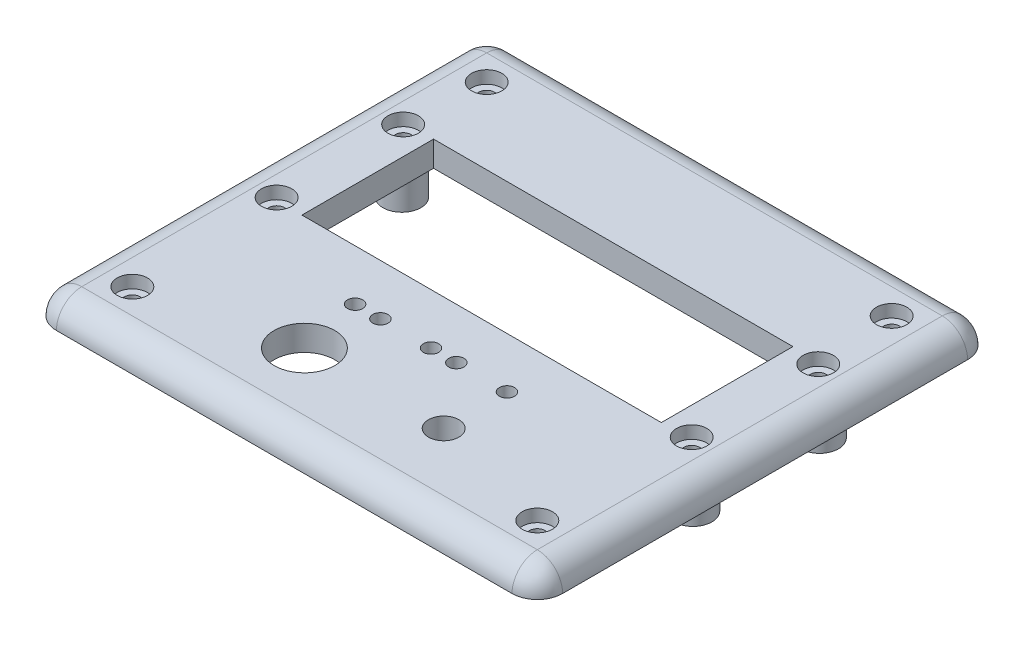
from build123d import *

# Parameters (mm, degrees)
SKETCH1_W               = 100
SKETCH1_H               = 90
BOSS_EXTRUDE1_DEPTH     = 5
FILLET1_R               = 5
FILLET2_R               = 5
SKETCH2_R               = 1.55
CUT_EXTRUDE1_DEPTH      = 10
SKETCH3_R               = 3
CUT_EXTRUDE2_DEPTH      = 2.5
SKETCH4_R               = 1.5
SKETCH4_W               = 71
SKETCH4_H               = 26
CUT_EXTRUDE3_DEPTH      = 135.629120178
SKETCH5_R               = 1.5
CUT_EXTRUDE4_DEPTH      = 135.629120178
SKETCH8_R               = 3.75
BOSS_EXTRUDE3_DEPTH     = 7.5
SKETCH6_R               = 3
CUT_EXTRUDE5_DEPTH      = 2.5
CUT_EXTRUDE7_DEPTH      = 135.745129782
CUT_EXTRUDE7_DEPTH_BACK = 135.745129782
SKETCH10_R              = 1.55
SKETCH11_R              = 6
SKETCH11_R_2            = 3
CUT_EXTRUDE8_DEPTH      = 5


with BuildPart() as part:
    # Sketch1 → Boss-Extrude1 (new body)
    with BuildSketch(Plane(origin=(0, 0, 0), x_dir=(1, 0, 0), z_dir=(0, 1, 0))):
        with Locations((50, 45)):
            Rectangle(SKETCH1_W, SKETCH1_H)
    extrude(amount=BOSS_EXTRUDE1_DEPTH)

    # Fillet1
    fillet1_edges = [part.edges().sort_by_distance(p)[0] for p in [
        (0, 2.5, -90),
        (100, 2.5, -90),
        (100, 2.5, 0),
        (0, 2.5, 0),
    ]]
    fillet(fillet1_edges, radius=FILLET1_R)

    # Fillet2
    fillet2_edges = [part.edges().sort_by_distance(p)[0] for p in [
        (1.464466094, 5, -1.464466094),
        (98.535533906, 5, -88.535533906),
        (98.535533906, 5, -1.464466094),
        (100, 5, -45),
        (50, 5, 0),
        (0, 5, -45),
        (1.464466094, 5, -88.535533906),
        (50, 5, -90),
    ]]
    fillet(fillet2_edges, radius=FILLET2_R - 0.0001)  # a hair under: the kernel refuses the full size

    # Sketch2 → Cut-Extrude1 (cut)
    with BuildSketch(Plane(origin=(0, 5, 0), x_dir=(1, 0, 0), z_dir=(0, 1, 0))):
        with Locations(Location((10, 80, 0), (0, 0, 270))):
            Circle(SKETCH2_R)
        with Locations(Location((10, 10, 0), (0, 0, 270))):
            Circle(SKETCH2_R)
        with Locations(Location((90, 10, 0), (0, 0, 270))):
            Circle(SKETCH2_R)
        with Locations(Location((90, 80, 0), (0, 0, 270))):
            Circle(SKETCH2_R)
    extrude(amount=-CUT_EXTRUDE1_DEPTH, mode=Mode.SUBTRACT)

    # Sketch3 → Cut-Extrude2 (cut)
    with BuildSketch(Plane(origin=(0, 5, 0), x_dir=(1, 0, 0), z_dir=(0, 1, 0))):
        with Locations(Location((10, 80, 0), (0, 0, 270))):
            Circle(SKETCH3_R)
        with Locations(Location((90, 80, 0), (0, 0, 270))):
            Circle(SKETCH3_R)
        with Locations(Location((90, 10, 0), (0, 0, 270))):
            Circle(SKETCH3_R)
        with Locations(Location((10, 10, 0), (0, 0, 270))):
            Circle(SKETCH3_R)
    extrude(amount=-CUT_EXTRUDE2_DEPTH, mode=Mode.SUBTRACT)

    # Sketch4 → Cut-Extrude3 (cut, through all)
    with BuildSketch(Plane(origin=(0, 5, 0), x_dir=(1, 0, 0), z_dir=(0, 1, 0))):
        with Locations(Location((35, 29, 0), (0, 0, 270))):
            Circle(SKETCH4_R)
        with Locations(Location((40, 29, 0), (0, 0, 270))):
            Circle(SKETCH4_R)
        with Locations(Location((50, 29, 0), (0, 0, 270))):
            Circle(SKETCH4_R)
        with Locations(Location((55, 29, 0), (0, 0, 270))):
            Circle(SKETCH4_R)
        with Locations(Location((65, 29, 0), (0, 0, 270))):
            Circle(SKETCH4_R)
        with Locations((50, 52)):
            Rectangle(SKETCH4_W, SKETCH4_H)
    extrude(amount=-CUT_EXTRUDE3_DEPTH, mode=Mode.SUBTRACT)

    # Sketch5 → Cut-Extrude4 (cut, through all)
    with BuildSketch(Plane.XZ):
        with Locations(Location((9, -39.5, 0), (0, 0, 270))):
            Circle(SKETCH5_R)
        with Locations(Location((9, -64.5, 0), (0, 0, 270))):
            Circle(SKETCH5_R)
        with Locations(Location((91, -64.5, 0), (0, 0, 270))):
            Circle(SKETCH5_R)
        with Locations(Location((91, -39.5, 0), (0, 0, 270))):
            Circle(SKETCH5_R)
    extrude(amount=-CUT_EXTRUDE4_DEPTH, mode=Mode.SUBTRACT)

    # Sketch8 → Boss-Extrude3 (add)
    with BuildSketch(Plane.XZ):
        with Locations(Location((8.75, -39.5, 0), (0, 0, 270))):
            Circle(SKETCH8_R)
        with Locations(Location((91.25, -39.5, 0), (0, 0, 270))):
            Circle(SKETCH8_R)
        with Locations(Location((91.25, -64.5, 0), (0, 0, 270))):
            Circle(SKETCH8_R)
        with Locations(Location((8.75, -64.5, 0), (0, 0, 270))):
            Circle(SKETCH8_R)
    extrude(amount=BOSS_EXTRUDE3_DEPTH)

    # Sketch6 → Cut-Extrude5 (cut)
    with BuildSketch(Plane(origin=(0, 5, 0), x_dir=(1, 0, 0), z_dir=(0, 1, 0))):
        with Locations(Location((9, 39.5, 0), (0, 0, 270))):
            Circle(SKETCH6_R)
        with Locations(Location((9, 64.5, 0), (0, 0, 270))):
            Circle(SKETCH6_R)
        with Locations(Location((91, 64.5, 0), (0, 0, 270))):
            Circle(SKETCH6_R)
        with Locations(Location((91, 39.5, 0), (0, 0, 270))):
            Circle(SKETCH6_R)
    extrude(amount=-CUT_EXTRUDE5_DEPTH, mode=Mode.SUBTRACT)

    # Sketch10 → Cut-Extrude7 (cut, two sides: drawn at the far end of the back side and taken through both)
    with BuildSketch(Plane(origin=(0, 0, 0), x_dir=(1, 0, 0), z_dir=(0, 1, 0)).offset(-CUT_EXTRUDE7_DEPTH_BACK)):
        with Locations(Location((9, 64.5, 0), (0, 0, 270))):
            Circle(SKETCH10_R)
        with Locations(Location((9, 39.5, 0), (0, 0, 270))):
            Circle(SKETCH10_R)
        with Locations(Location((91, 39.5, 0), (0, 0, 270))):
            Circle(SKETCH10_R)
        with Locations(Location((91, 64.5, 0), (0, 0, 270))):
            Circle(SKETCH10_R)
    extrude(amount=CUT_EXTRUDE7_DEPTH + CUT_EXTRUDE7_DEPTH_BACK, mode=Mode.SUBTRACT)

    # Sketch11 → Cut-Extrude8 (cut)
    with BuildSketch(Plane(origin=(0, 5, 0), x_dir=(1, 0, 0), z_dir=(0, 1, 0))):
        with Locations(Location((37.5, 16.5, 0), (0, 0, 270))):
            Circle(SKETCH11_R)
        with Locations(Location((65, 16.5, 0), (0, 0, 270))):
            Circle(SKETCH11_R_2)
    extrude(amount=-CUT_EXTRUDE8_DEPTH, mode=Mode.SUBTRACT)


solid = part.part
